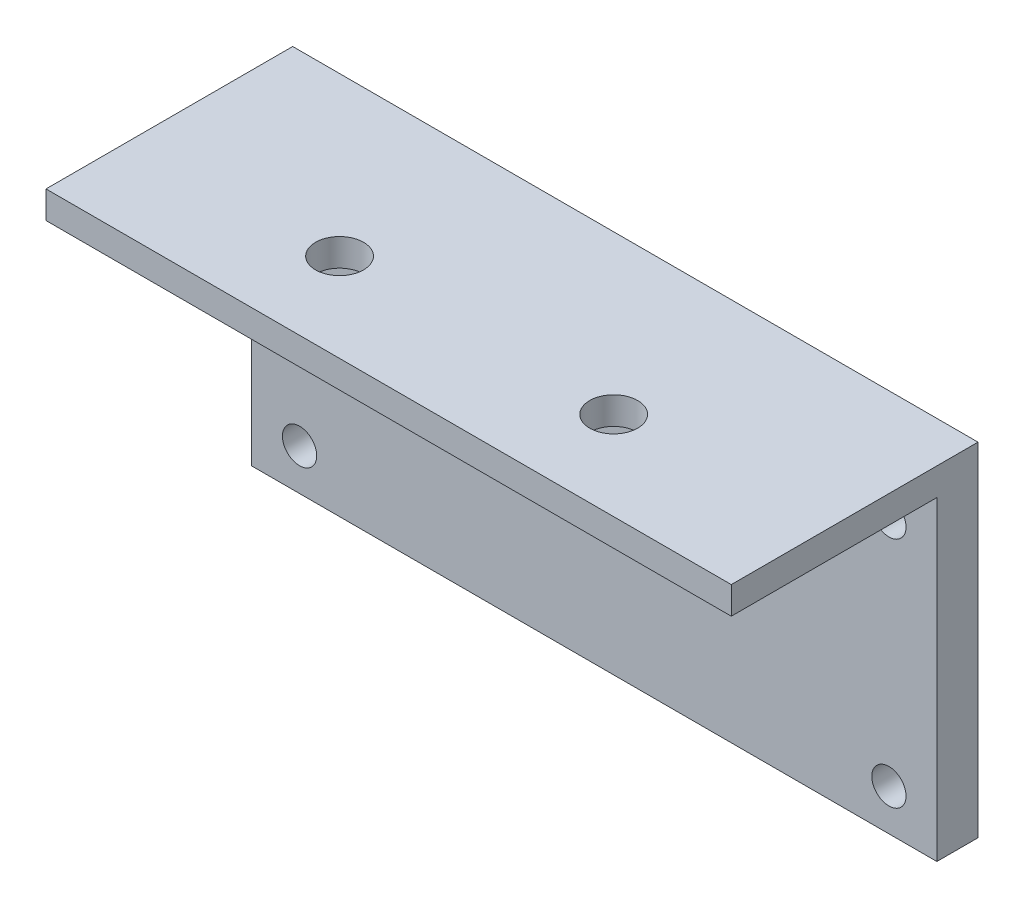
from build123d import *

# Parameters (mm, degrees)
SKETCH1_W           = 50
SKETCH1_H           = 25
BOSS_EXTRUDE1_DEPTH = 3
SKETCH3_W           = 50
SKETCH3_H           = 2
BOSS_EXTRUDE2_DEPTH = 15
SKETCH5_R           = 1.25
CUT_EXTRUDE1_DEPTH  = 15
SKETCH6_R           = 1.75
CUT_EXTRUDE2_DEPTH  = 15


with BuildPart() as part:
    # Sketch1 → Boss-Extrude1 (new body)
    with BuildSketch(Plane.XY):
        with Locations((-25, 12.5)):
            Rectangle(SKETCH1_W, SKETCH1_H)
    extrude(amount=BOSS_EXTRUDE1_DEPTH)

    # Sketch3 → Boss-Extrude2 (add)
    with BuildSketch(Plane.XY.offset(3)):
        with Locations((-25, 24)):
            Rectangle(SKETCH3_W, SKETCH3_H)
    extrude(amount=BOSS_EXTRUDE2_DEPTH)

    # Sketch5 → Cut-Extrude1 (cut)
    with BuildSketch(Plane.XY.offset(3)):
        with Locations((-46.500140762, 20.00924034)):
            Circle(SKETCH5_R)
        with Locations((-46.500140762, 3.00924034)):
            Circle(SKETCH5_R)
        with Locations((-3.500140762, 20.00924034)):
            Circle(SKETCH5_R)
        with Locations((-3.500140762, 3.00924034)):
            Circle(SKETCH5_R)
    extrude(amount=-CUT_EXTRUDE1_DEPTH, mode=Mode.SUBTRACT)

    # Sketch6 → Cut-Extrude2 (cut)
    with BuildSketch(Plane(origin=(0, 25, 0), x_dir=(1, 0, 0), z_dir=(0, 1, 0))):
        with Locations((-35.046148944, -11.535217426)):
            Circle(SKETCH6_R)
        with Locations((-15.046148944, -11.535217426)):
            Circle(SKETCH6_R)
    extrude(amount=-CUT_EXTRUDE2_DEPTH, mode=Mode.SUBTRACT)


solid = part.part
